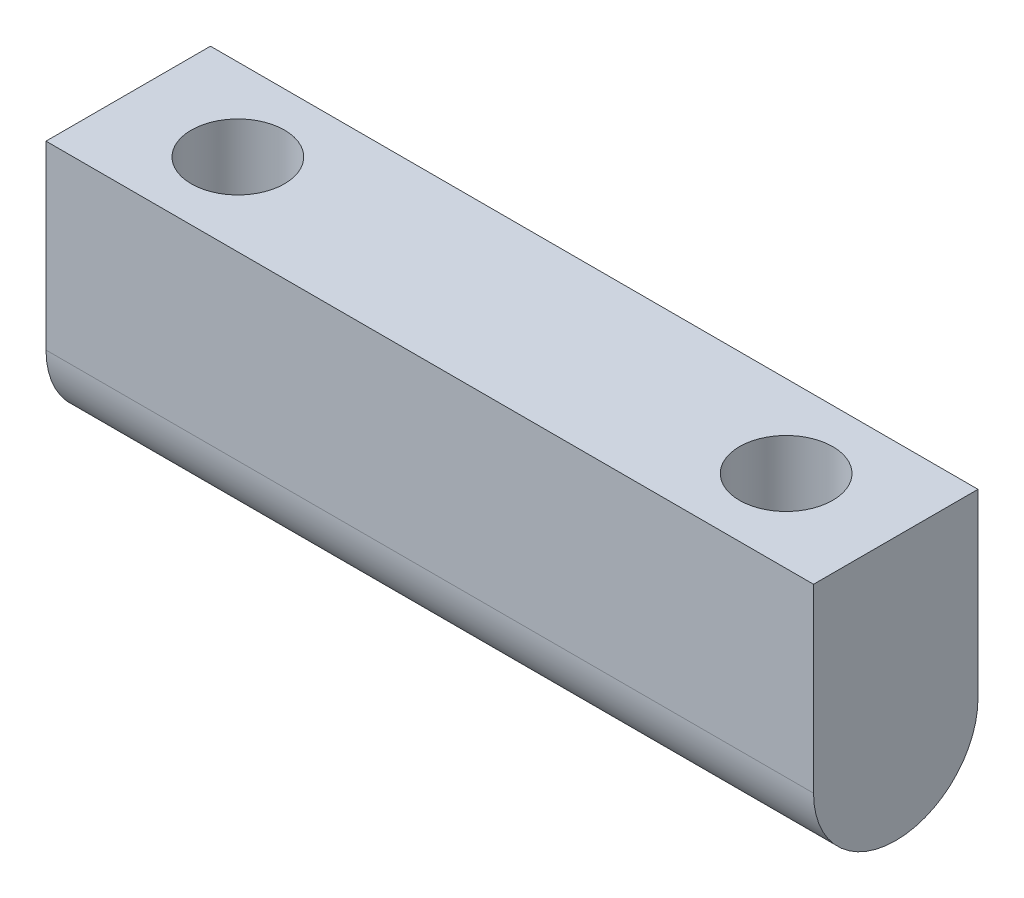
from build123d import *
from OCP.BRepFilletAPI import BRepFilletAPI_MakeChamfer

# Parameters (mm, degrees)
SKETCH1_W           = 70
SKETCH1_H           = 15
SKETCH1_R           = 4.25
BOSS_EXTRUDE1_DEPTH = 20
SKETCH2_W           = 70
SKETCH2_H           = 15
BOSS_EXTRUDE2_DEPTH = 4
FILLET1_R           = 7.5
CHAMFER1_SIZE       = 10
CHAMFER1_SIZE2      = 0.174550649


with BuildPart() as part:
    # Sketch1 → Boss-Extrude1 (new body)
    with BuildSketch(Plane(origin=(0, 0, 0), x_dir=(1, 0, 0), z_dir=(0, 1, 0))):
        Rectangle(SKETCH1_W, SKETCH1_H)
        with Locations(Location((-25, 0, 0), (0, 0, 270))):
            Circle(SKETCH1_R, mode=Mode.SUBTRACT)
        with Locations(Location((25, 0, 0), (0, 0, 270))):
            Circle(SKETCH1_R, mode=Mode.SUBTRACT)
    extrude(amount=BOSS_EXTRUDE1_DEPTH)

    # Sketch2 → Boss-Extrude2 (add)
    with BuildSketch(Plane.XZ):
        Rectangle(SKETCH2_W, SKETCH2_H)
    extrude(amount=BOSS_EXTRUDE2_DEPTH)

    # Fillet1
    fillet1_edges = [part.edges().sort_by_distance(p)[0] for p in [
        (0, -4, 7.5),
        (0, -4, -7.5),
    ]]
    fillet(fillet1_edges, radius=FILLET1_R - 0.0001)  # a hair under: the kernel refuses the full size

    # Chamfer1: one chamfer whose edges measure the first distance from different faces: ONE call of the kernel's chamfer builder (chamfer() names one face for all edges)
    chamfer1_edges_1 = [part.edges().sort_by_distance(p)[0] for p in [
        (-25, 0, -4.25),
    ]]
    chamfer1_side_1 = [part.faces().sort_by_distance(p)[0] for p in [
        (-25, 10, -4.25),
    ]]
    chamfer1_edges_2 = [part.edges().sort_by_distance(p)[0] for p in [
        (25, 0, -4.25),
    ]]
    chamfer1_side_2 = [part.faces().sort_by_distance(p)[0] for p in [
        (25, 10, -4.25),
    ]]
    chamfer1 = BRepFilletAPI_MakeChamfer(part.part.solid().wrapped)
    for e in chamfer1_edges_1:
        chamfer1.Add(CHAMFER1_SIZE, CHAMFER1_SIZE2, e.wrapped, chamfer1_side_1[0].wrapped)  # the first distance lies on this face
    for e in chamfer1_edges_2:
        chamfer1.Add(CHAMFER1_SIZE, CHAMFER1_SIZE2, e.wrapped, chamfer1_side_2[0].wrapped)  # the first distance lies on this face
    add(Compound.cast(chamfer1.Shape()), mode=Mode.REPLACE)


solid = part.part
